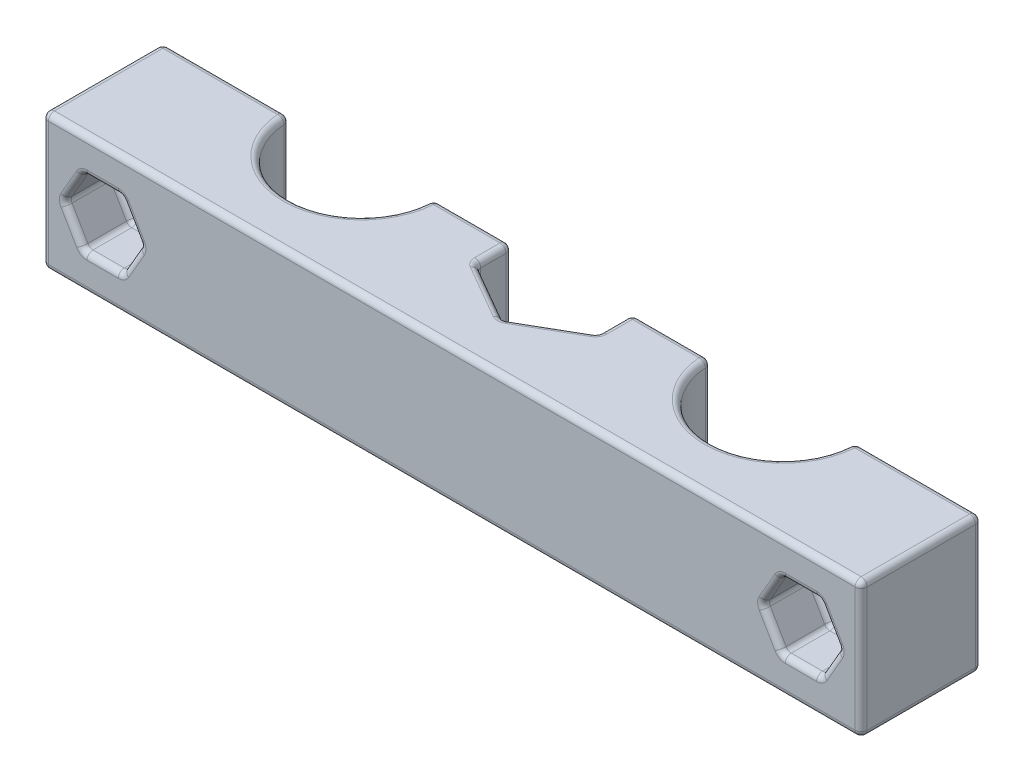
from build123d import *

# Parameters (mm, degrees)
BOSS_EXTRUDE1_DEPTH = 11.3
SKETCH2_R           = 1.6
CUT_EXTRUDE1_DEPTH  = 70.654073822
CUT_EXTRUDE3_DEPTH  = 4.2
FILLET5_R           = 0.5


with BuildPart() as part:
    # Sketch1 → Boss-Extrude1 (new body)
    with BuildSketch(Plane(origin=(0, 0, 0), x_dir=(1, 0, 0), z_dir=(0, 1, 0))):
        with BuildLine():
            Line((57.5, 10), (68, 10))
            Line((68, 10), (68, 0))
            Line((68, 0), (0, 0))
            Line((0, 0), (0, 10))
            Line((0, 10), (10.5, 10))
            ThreePointArc((10.5, 10), (16.5, 4), (22.5, 10))
            Line((22.5, 10), (29, 10))
            Line((29, 10), (29, 7.113248654))
            Line((29, 7.113248654), (34, 4.226497308))
            Line((34, 4.226497308), (39, 7.113248654))
            Line((39, 7.113248654), (39, 10))
            Line((39, 10), (45.5, 10))
            ThreePointArc((45.5, 10), (51.5, 4), (57.5, 10))
        make_face()
    extrude(amount=BOSS_EXTRUDE1_DEPTH)

    # Sketch2 → Cut-Extrude1 (cut, through all)
    with BuildSketch(Plane.XY):
        with Locations((5, 5.65)):
            Circle(SKETCH2_R)
        with Locations((63, 5.65)):
            Circle(SKETCH2_R)
    extrude(amount=-CUT_EXTRUDE1_DEPTH, mode=Mode.SUBTRACT)

    # Sketch4 → Cut-Extrude3 (cut)
    with BuildSketch(Plane.XY):
        Polygon((8.175426481, 5.65), (6.58771324, 8.4), (3.41228676, 8.4), (1.824573519, 5.65), (3.41228676, 2.9), (6.58771324, 2.9), align=None)
        Polygon((61.41228676, 2.9), (59.824573519, 5.65), (61.41228676, 8.4), (64.58771324, 8.4), (66.175426481, 5.65), (64.58771324, 2.9), align=None)
    extrude(amount=-CUT_EXTRUDE3_DEPTH, mode=Mode.SUBTRACT)

    # Fillet5
    fillet5_edges = [part.edges().sort_by_distance(p)[0] for p in [
        (61.41228676, 8.4, -2.1),
        (59.824573519, 5.65, -2.1),
        (61.41228676, 2.9, -2.1),
        (64.58771324, 2.9, -2.1),
        (66.175426481, 5.65, -2.1),
        (64.58771324, 8.4, -2.1),
        (61.4, 5.65, -4.2),
        (60.61843014, 4.275, -4.2),
        (60.61843014, 7.025, -4.2),
        (63, 8.4, -4.2),
        (65.38156986, 7.025, -4.2),
        (65.38156986, 4.275, -4.2),
        (63, 2.9, -4.2),
        (6.58771324, 2.9, -2.1),
        (8.175426481, 5.65, -2.1),
        (1.824573519, 5.65, -2.1),
        (3.41228676, 2.9, -2.1),
        (6.58771324, 8.4, -2.1),
        (3.41228676, 8.4, -2.1),
        (3.4, 5.65, -4.2),
        (5, 2.9, -4.2),
        (2.61843014, 4.275, -4.2),
        (2.61843014, 7.025, -4.2),
        (5, 8.4, -4.2),
        (7.38156986, 7.025, -4.2),
        (7.38156986, 4.275, -4.2),
        (68, 0, -5),
        (39, 0, -8.556624327),
        (29, 0, -8.556624327),
        (0, 0, -5),
        (68, 5.65, -10),
        (62.75, 0, -10),
        (61.4, 5.65, -10),
        (57.5, 5.65, -10),
        (51.5, 0, -4),
        (45.5, 5.65, -10),
        (39, 5.65, -10),
        (42.25, 0, -10),
        (39, 5.65, -7.113248654),
        (36.5, 0, -5.669872981),
        (34, 5.65, -4.226497308),
        (29, 5.65, -7.113248654),
        (31.5, 0, -5.669872981),
        (29, 5.65, -10),
        (25.75, 0, -10),
        (22.5, 5.65, -10),
        (16.5, 0, -4),
        (10.5, 5.65, -10),
        (0, 5.65, -10),
        (5.25, 0, -10),
        (3.4, 5.65, -10),
        (5.25, 11.3, -10),
        (16.5, 11.3, -4),
        (25.75, 11.3, -10),
        (29, 11.3, -8.556624327),
        (31.5, 11.3, -5.669872981),
        (36.5, 11.3, -5.669872981),
        (39, 11.3, -8.556624327),
        (42.25, 11.3, -10),
        (51.5, 11.3, -4),
        (62.75, 11.3, -10),
        (68, 11.3, -5),
        (0, 11.3, -5),
        (0, 5.65, 0),
        (34, 11.3, 0),
        (68, 5.65, 0),
        (34, 0, 0),
        (65.38156986, 7.025, 0),
        (63, 8.4, 0),
        (60.61843014, 7.025, 0),
        (60.61843014, 4.275, 0),
        (63, 2.9, 0),
        (65.38156986, 4.275, 0),
        (5, 8.4, 0),
        (2.61843014, 7.025, 0),
        (2.61843014, 4.275, 0),
        (5, 2.9, 0),
        (7.38156986, 4.275, 0),
        (7.38156986, 7.025, 0),
    ]]
    fillet(fillet5_edges, radius=FILLET5_R)


solid = part.part
